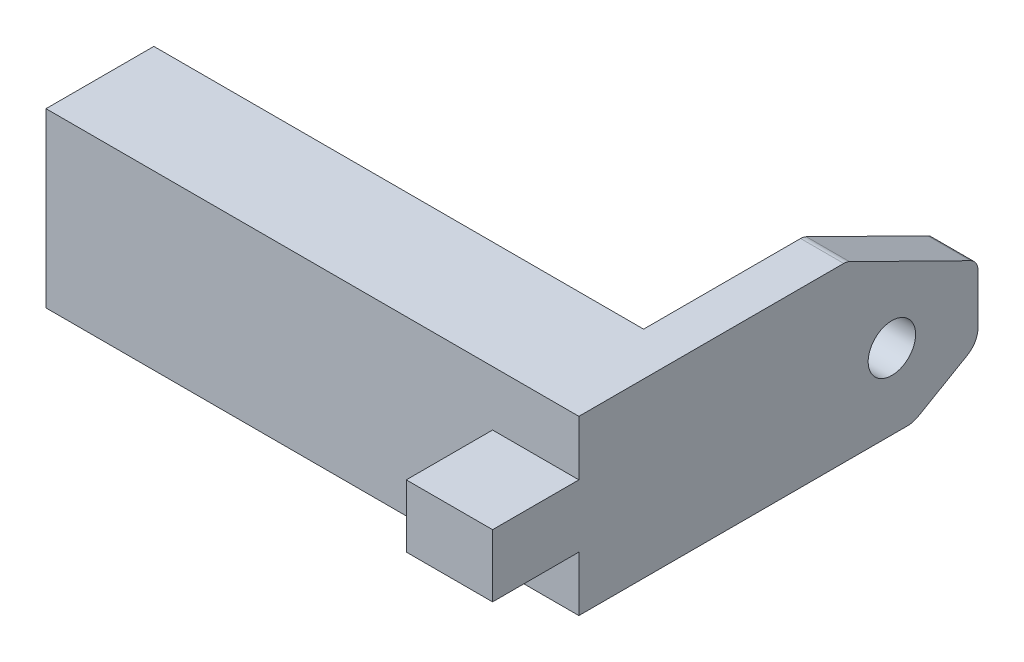
from build123d import *

# Parameters (mm, degrees)
SKETCH1_W           = 92.5
SKETCH1_H           = 40
BOSS_EXTRUDE1_DEPTH = 10
SKETCH5_R           = 5.5
CUT_EXTRUDE1_DEPTH  = 27
SKETCH4_W           = 25
SKETCH4_H           = 40
SKETCH4_W_2         = 10.25
SKETCH4_H_2         = 25.25
BOSS_EXTRUDE7_DEPTH = 113.5
FILLET1_R           = 3
CHAMFER1_SIZE       = 15
CHAMFER1_SIZE2      = 30.41699103
FILLET3_R           = 3
CHAMFER3_SIZE       = 15
CHAMFER3_SIZE2      = 8.660254038
FILLET7_R           = 5
SKETCH7_W           = 20
SKETCH7_H           = 14.5
BOSS_EXTRUDE8_DEPTH = 20


with BuildPart() as part:
    # Sketch1 → Boss-Extrude1 (new body)
    with BuildSketch(Plane(origin=(0, 0, 0), x_dir=(0, 0, -1), z_dir=(1, 0, 0))):
        with Locations((10.335365854, 0.129573171)):
            Rectangle(SKETCH1_W, SKETCH1_H)
    extrude(amount=BOSS_EXTRUDE1_DEPTH)

    # Sketch5 → Cut-Extrude1 (cut)
    with BuildSketch(Plane.ZY):
        with Locations((-36.625365854, -2.430426829)):
            Circle(SKETCH5_R)
    extrude(amount=-CUT_EXTRUDE1_DEPTH, mode=Mode.SUBTRACT)

    # Sketch4 → Boss-Extrude7 (add)
    with BuildSketch(Plane.ZY):
        with Locations((23.414634146, 0.129573171)):
            Rectangle(SKETCH4_W, SKETCH4_H)
        with Locations((23.414634146, 0.129573171)):
            Rectangle(SKETCH4_W_2, SKETCH4_H_2, mode=Mode.SUBTRACT)
    extrude(amount=BOSS_EXTRUDE7_DEPTH)

    # Fillet1
    fillet1_edges = [part.edges().sort_by_distance(p)[0] for p in [
        (-113.5, -12.495426829, 23.414634146),
        (-113.5, 0.129573171, 28.539634146),
        (-113.5, 12.754573171, 23.414634146),
        (-113.5, 0.129573171, 18.289634146),
    ]]
    fillet(fillet1_edges, radius=FILLET1_R)

    # Chamfer1
    chamfer1_edges = [part.edges().sort_by_distance(p)[0] for p in [
        (5, 20.129573171, -56.585365854),
    ]]
    chamfer1_side = [part.faces().sort_by_distance(p)[0] for p in [
        (5, 0.129573171, -56.585365854),
    ]]
    chamfer(chamfer1_edges, length=CHAMFER1_SIZE, length2=CHAMFER1_SIZE2, reference=chamfer1_side[0])

    # Fillet3
    fillet3_edges = [part.edges().sort_by_distance(p)[0] for p in [
        (5, 20.129573171, -26.168374824),
        (5, 5.129573171, -56.585365854),
    ]]
    fillet(fillet3_edges, radius=FILLET3_R)

    # Chamfer3
    chamfer3_edges = [part.edges().sort_by_distance(p)[0] for p in [
        (5, -19.870426829, -56.585365854),
    ]]
    chamfer3_side = [part.faces().sort_by_distance(p)[0] for p in [
        (-41.568936877, -19.870426829, 15.117291954),
    ]]
    chamfer(chamfer3_edges, length=CHAMFER3_SIZE, length2=CHAMFER3_SIZE2, reference=chamfer3_side[0])

    # Fillet7
    fillet7_edges = [part.edges().sort_by_distance(p)[0] for p in [
        (5, -19.870426829, -41.585365854),
        (5, -11.210172791, -56.585365854),
    ]]
    fillet(fillet7_edges, radius=FILLET7_R)

    # Sketch7 → Boss-Extrude8 (add)
    with BuildSketch(Plane(origin=(10, 20.129573171, 35.914634146), x_dir=(1, 0, 0), z_dir=(0, 0, 1))):
        with Locations((-10, -20)):
            Rectangle(SKETCH7_W, SKETCH7_H)
    extrude(amount=BOSS_EXTRUDE8_DEPTH)


solid = part.part
